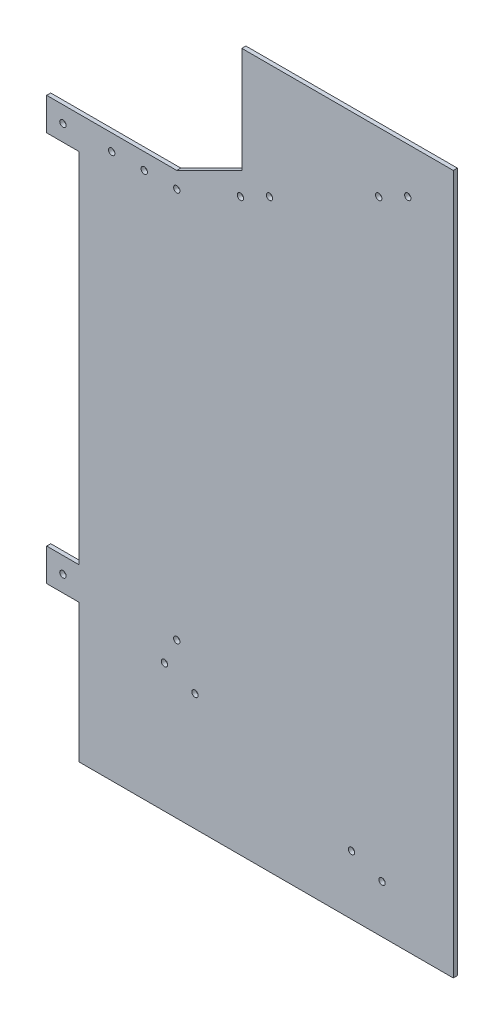
from build123d import *

# Parameters (mm, degrees)
BOSS_EXTRUDE1_DEPTH        = 3.175
F_9_0_196_DIAMETER_HOLE1_D = 4.9784
F_9_0_196_DIAMETER_HOLE2_D = 4.9784


with BuildPart() as part:
    # Sketch1 → Boss-Extrude1 (new body)
    with BuildSketch(Plane(origin=(0, 0, 0), x_dir=(0, 1, 0), z_dir=(0, 0, 1))):
        Polygon((-330.2, -25.4), (-330.2, 0), (-304.8, 0), (-304.8, -25.4), (-25.4, -25.4), (-25.4, 0), (0, 0), (0, -101.6), (25.4, -152.4), (107.95, -152.4), (107.95, -317.5), (-438.15, -317.5), (-438.15, -25.4), align=None)
    extrude(amount=BOSS_EXTRUDE1_DEPTH)

    # #9 (0.196) Diameter Hole1 (through all)
    with Locations(Plane(origin=(0, 0, 0), x_dir=(1, 0, 0), z_dir=(0, 0, -1))):
        with Locations((12.7, 317.5), (12.7, 12.7), (101.6, 317.5), (101.6, 12.7), (50.8, 12.7), (76.2, 12.7)):
            Hole(F_9_0_196_DIAMETER_HOLE1_D / 2)

    # #9 (0.196) Diameter Hole2 (through all)
    with Locations(Plane.XY.offset(3.175)):
        with Locations((261.890601121, -400.67429412), (174.033741154, 18.468081006), (151.315290503, 7.10885568), (259.265290503, 61.08385568), (281.983741154, 72.443081006), (92.015540851, -337.894380542), (115.840601121, -346.69929412), (238.065540851, -391.869380542)):
            Hole(F_9_0_196_DIAMETER_HOLE2_D / 2)


solid = part.part
